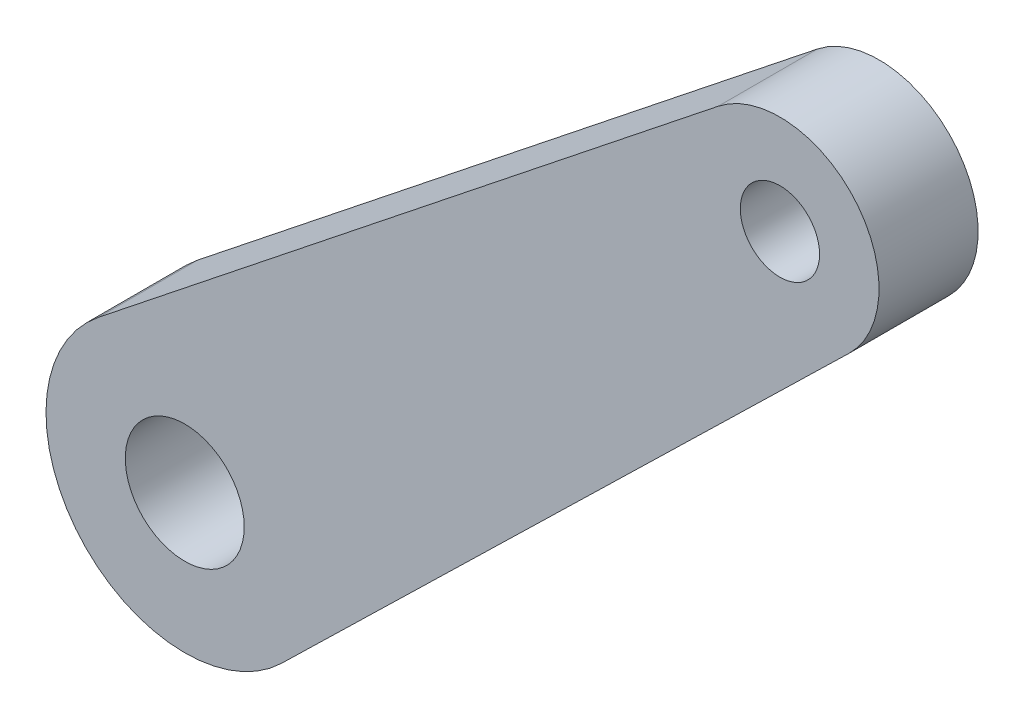
from build123d import *

# Parameters (mm, degrees)
BOSS_EXTRUDE1_START = 10
SKETCH1_R           = 3
SKETCH1_R_2         = 2
BOSS_EXTRUDE1_DEPTH = 5


with BuildPart() as part:
    # Sketch1 → Boss-Extrude1 (new body)
    with BuildSketch(Plane.XY.offset(BOSS_EXTRUDE1_START)):
        with BuildLine():
            Line((-54.356103807, 23.479448843), (-23.084130977, 48.340336101))
            ThreePointArc((-23.084130977, 48.340336101), (-16.219206789, 47.729749579), (-16.485783391, 40.842882591))
            Line((-16.485783391, 40.842882591), (-45.118417187, 12.983013929))
            ThreePointArc((-45.118417187, 12.983013929), (-55.254790055, 13.375372288), (-54.356103807, 23.479448843))
        make_face()
        with Locations((-50, 18)):
            Circle(SKETCH1_R, mode=Mode.SUBTRACT)
        with Locations((-19.972628257, 44.426444071)):
            Circle(SKETCH1_R_2, mode=Mode.SUBTRACT)
    extrude(amount=BOSS_EXTRUDE1_DEPTH)


solid = part.part
